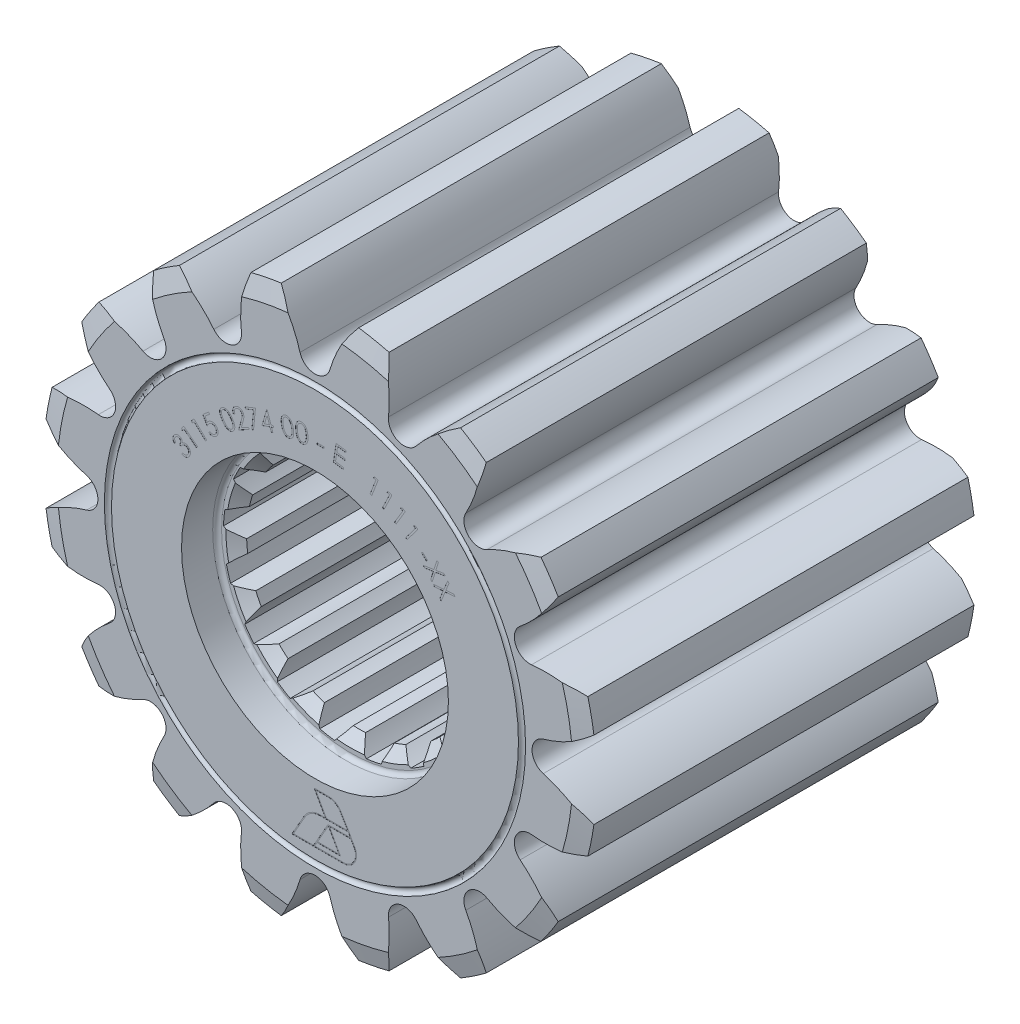
from build123d import *

# Parameters (mm, degrees)
CUT_EXTRUDE1_DEPTH = 63.106702537
CIRPATTERN1_COUNT  = 16
CUT_EXTRUDE2_DEPTH = 62.801274429
CIRPATTERN2_COUNT  = 17
PARTNO_DEPTH       = 0.01


with BuildPart() as part:
    # Sketch2 → Revolve1 (revolve)
    with BuildSketch(Plane(origin=(0, 0, 0), x_dir=(0, 0, -1), z_dir=(1, 0, 0))):
        with BuildLine():
            Line((0, 15), (0, 22.875))
            ThreePointArc((0, 22.875), (-0.4, 23.275), (0, 23.675))
            Line((0, 23.675), (0, 29))
            Line((0, 29), (-0.562693304, 31.1))
            Line((-0.562693304, 31.1), (-43.287306696, 31.1))
            Line((-43.287306696, 31.1), (-43.85, 29))
            Line((-43.85, 29), (-43.85, 23.675))
            ThreePointArc((-43.85, 23.675), (-43.45, 23.275), (-43.85, 22.875))
            Line((-43.85, 22.875), (-43.85, 15))
            Line((-43.85, 15), (-40.35, 15))
            ThreePointArc((-40.35, 15), (-39.996446609, 14.853553391), (-39.85, 14.5))
            Line((-39.85, 14.5), (-39.85, 14))
            Line((-39.85, 14), (-38.85, 12.69))
            Line((-38.85, 12.69), (-5, 12.69))
            Line((-5, 12.69), (-4, 14))
            Line((-4, 14), (-4, 14.5))
            ThreePointArc((-4, 14.5), (-3.853553391, 14.853553391), (-3.5, 15))
            Line((-3.5, 15), (0, 15))
        make_face()
    revolve(axis=Axis((0, 0, 0), (0, 0, 1)))

    # Sketch3 → Cut-Extrude1 (cut, through all)
    with BuildSketch(Plane.XY):
        with BuildLine():
            ThreePointArc((4.35, 30.794277066), (0, 31.1), (-4.35, 30.794277066))
            ThreePointArc((-4.35, 30.794277066), (-2.764629435, 28.35739577), (-1.679111514, 25.660463972))
            ThreePointArc((-1.679111514, 25.660463972), (0, 24.4035), (1.679111514, 25.660463972))
            ThreePointArc((1.679111514, 25.660463972), (2.764629435, 28.35739577), (4.35, 30.794277066))
        make_face()
    cut_extrude1 = extrude(amount=CUT_EXTRUDE1_DEPTH, mode=Mode.SUBTRACT)

    # CirPattern1: Cut-Extrude1 ×16 about axis
    cirpattern1_axis = Axis((0, 0, 5), (0, 0, 1))
    for i in range(1, CIRPATTERN1_COUNT):
        add(cut_extrude1.rotate(cirpattern1_axis, i * 360 / CIRPATTERN1_COUNT), mode=Mode.SUBTRACT)

    # Sketch4 → Cut-Extrude2 (cut, through all)
    with BuildSketch(Plane.XY):
        with BuildLine():
            ThreePointArc((0.85, 14.264697683), (0, 14.29), (-0.85, 14.264697683))
            ThreePointArc((-0.85, 14.264697683), (-1.276543067, 13.436106806), (-1.65, 12.582273245))
            ThreePointArc((-1.65, 12.582273245), (0, 12.69), (1.65, 12.582273245))
            ThreePointArc((1.65, 12.582273245), (1.276543067, 13.436106806), (0.85, 14.264697683))
        make_face()
    cut_extrude2 = extrude(amount=CUT_EXTRUDE2_DEPTH, mode=Mode.SUBTRACT)

    # CirPattern2: Cut-Extrude2 ×17 about axis
    cirpattern2_axis = Axis((0, 0, 5), (0, 0, 1))
    for i in range(1, CIRPATTERN2_COUNT):
        add(cut_extrude2.rotate(cirpattern2_axis, i * 360 / CIRPATTERN2_COUNT), mode=Mode.SUBTRACT)

    # Sketch5 → PARTNO (cut)
    # profile 1 of 20: a face of its own
    with BuildSketch(Plane.XY.offset(43.85)):
        with BuildLine():
            Line((-15.658012961, 9.888042357), (-15.772195653, 9.718971844))
            add(Edge.make_bspline(
                [(-15.772195653, 9.718971844), (-15.78603067, 9.734282455), (-15.813212263, 9.76436314), (-15.849555861, 9.811681363), (-15.881533398, 9.859466346), (-15.908380508, 9.908018341), (-15.930702895, 9.957121523), (-15.947902224, 10.007073924), (-15.96084882, 10.057556524), (-15.968939443, 10.108536251), (-15.971869176, 10.159362897), (-15.971410312, 10.209644733), (-15.965660473, 10.25899995), (-15.955525406, 10.30751364), (-15.941163164, 10.355155751), (-15.922077875, 10.402064167), (-15.898558566, 10.448025044), (-15.879809697, 10.477394814), (-15.870352704, 10.492209023)],
                knots=[0, 0, 0, 0, 1.167337146, 2.293461821, 3.372899211, 4.418145347, 5.429484345, 6.421322249, 7.403758633, 8.375351629, 9.337018697, 10.281789974, 11.217327747, 12.143663286, 13.083221491, 14.02908024, 15.005861512, 16, 16, 16, 16], degree=3))
            add(Edge.make_bspline(
                [(-15.870352704, 10.492209023), (-15.855426036, 10.513110766), (-15.825876427, 10.55448894), (-15.771947061, 10.607932078), (-15.713628984, 10.655684772), (-15.649302403, 10.694901857), (-15.581798296, 10.72598863), (-15.512576022, 10.748190148), (-15.442393007, 10.759956828), (-15.372186732, 10.761204484), (-15.303552586, 10.754405706), (-15.238317398, 10.738072312), (-15.17670949, 10.714336666), (-15.139677276, 10.691521615), (-15.121153987, 10.680109664)],
                knots=[0, 0, 0, 0, 1.077593829, 2.133260695, 3.178944316, 4.239701202, 5.289443528, 6.295878546, 7.285905084, 8.268330171, 9.238933244, 10.175446198, 11.087369189, 12, 12, 12, 12], degree=3))
            add(Edge.make_bspline(
                [(-15.121153987, 10.680109664), (-15.104048962, 10.667779614), (-15.07052077, 10.643611025), (-15.027817793, 10.599367332), (-14.991597877, 10.551170603), (-14.963403591, 10.497522355), (-14.94256879, 10.439378851), (-14.928850016, 10.376521279), (-14.923039757, 10.308946391), (-14.92449253, 10.26251142), (-14.925240525, 10.238603254)],
                knots=[0, 0, 0, 0, 0.995000218, 1.950336737, 2.893518646, 3.836763937, 4.803298618, 5.805085003, 6.869895052, 8, 8, 8, 8], degree=3))
            add(Edge.make_bspline(
                [(-14.925240525, 10.238603254), (-14.903646826, 10.252124466), (-14.861248556, 10.278672767), (-14.793012518, 10.30834961), (-14.723051343, 10.329462909), (-14.675101803, 10.335669785), (-14.651202063, 10.338763511)],
                knots=[0, 0, 0, 0, 1.036066809, 2.034271235, 3.020211564, 4, 4, 4, 4], degree=3))
            add(Edge.make_bspline(
                [(-14.651202063, 10.338763511), (-14.634383712, 10.339987219), (-14.601167849, 10.342404016), (-14.551716718, 10.34097381), (-14.503520305, 10.336081991), (-14.456749487, 10.325997972), (-14.410945833, 10.31320078), (-14.366924877, 10.29517883), (-14.323800578, 10.274025545), (-14.296743881, 10.25664062), (-14.283012961, 10.247817998)],
                knots=[0, 0, 0, 0, 1.044903547, 2.063660846, 3.063088482, 4.043924196, 5.026610512, 6.007586015, 6.988875973, 8, 8, 8, 8], degree=3))
            add(Edge.make_bspline(
                [(-14.283012961, 10.247817998), (-14.26033606, 10.231197929), (-14.215004844, 10.197974346), (-14.156006737, 10.137072555), (-14.105192038, 10.068165283), (-14.062610412, 9.992615653), (-14.029758389, 9.91204727), (-14.008109802, 9.828378177), (-13.999024483, 9.742566557), (-14.001434302, 9.655653685), (-14.015650138, 9.568806839), (-14.0409896, 9.483376473), (-14.078127339, 9.40008706), (-14.110630024, 9.34802106), (-14.127163602, 9.321535946)],
                knots=[0, 0, 0, 0, 0.966170603, 1.931378862, 2.9038575, 3.905996855, 4.907914887, 5.889924786, 6.86994318, 7.867604432, 8.873236304, 9.889647813, 10.926498726, 12, 12, 12, 12], degree=3))
            add(Edge.make_bspline(
                [(-14.127163602, 9.321535946), (-14.139333892, 9.304388267), (-14.16329502, 9.270627548), (-14.202907908, 9.224054182), (-14.245353393, 9.182777964), (-14.289308034, 9.145335953), (-14.336653744, 9.113829279), (-14.385780946, 9.086326154), (-14.437716665, 9.064239032), (-14.491558153, 9.046639635), (-14.547448343, 9.033926387), (-14.605100465, 9.02783744), (-14.664092891, 9.026509123), (-14.724579923, 9.031047253), (-14.786412986, 9.041338914), (-14.849990543, 9.056498495), (-14.914846551, 9.077872069), (-14.957802035, 9.095692904), (-14.979727704, 9.104789152)],
                knots=[0, 0, 0, 0, 1.043382585, 2.05423396, 3.029176167, 3.979702728, 4.915461935, 5.847056597, 6.770503734, 7.711670308, 8.655656949, 9.609436654, 10.584018272, 11.580952161, 12.615092949, 13.692247982, 14.82205938, 16, 16, 16, 16], degree=3))
            Line((-14.979727704, 9.104789152), (-14.870352704, 9.267048767))
            add(Edge.make_bspline(
                [(-14.870352704, 9.267048767), (-14.854903646, 9.26197229), (-14.824865207, 9.252101822), (-14.780389824, 9.239952888), (-14.737811157, 9.231186158), (-14.697315164, 9.224967595), (-14.658725357, 9.222034498), (-14.622165875, 9.222558897), (-14.587479555, 9.225342268), (-14.565425945, 9.230213095), (-14.554647576, 9.232593639)],
                knots=[0, 0, 0, 0, 1.212571523, 2.357668232, 3.435804907, 4.45268296, 5.411272589, 6.317584373, 7.177744739, 8, 8, 8, 8], degree=3))
            add(Edge.make_bspline(
                [(-14.554647576, 9.232593639), (-14.541475283, 9.236343763), (-14.515223191, 9.243817678), (-14.477316071, 9.259627156), (-14.441206888, 9.279430402), (-14.406616327, 9.302625803), (-14.374031743, 9.329902741), (-14.342741241, 9.360239925), (-14.313215249, 9.394560394), (-14.295621464, 9.419666649), (-14.28661873, 9.432513511)],
                knots=[0, 0, 0, 0, 0.960147248, 1.913552354, 2.873562481, 3.845339491, 4.830124943, 5.850366078, 6.900033086, 8, 8, 8, 8], degree=3))
            add(Edge.make_bspline(
                [(-14.28661873, 9.432513511), (-14.276987762, 9.447439666), (-14.258251452, 9.476477358), (-14.235399188, 9.521966459), (-14.216658839, 9.567088691), (-14.20343103, 9.612669853), (-14.194937836, 9.658155191), (-14.191114239, 9.703826726), (-14.193013037, 9.749467758), (-14.198835008, 9.794719862), (-14.209445906, 9.838447849), (-14.222913913, 9.88038558), (-14.240146889, 9.919763103), (-14.26105043, 9.956463394), (-14.28563971, 9.990205955), (-14.313559612, 10.021338157), (-14.344859196, 10.049920731), (-14.367914231, 10.066673827), (-14.379567448, 10.075141716)],
                knots=[0, 0, 0, 0, 1.175396333, 2.286643493, 3.365472874, 4.40641989, 5.422738212, 6.425112482, 7.43378543, 8.441760468, 9.441244357, 10.408768253, 11.355088161, 12.281871839, 13.199839301, 14.114093995, 15.046764744, 16, 16, 16, 16], degree=3))
            add(Edge.make_bspline(
                [(-14.379567448, 10.075141716), (-14.395983002, 10.085287024), (-14.428543266, 10.105410252), (-14.482370854, 10.126239723), (-14.539072139, 10.139063938), (-14.5979616, 10.144127213), (-14.657338468, 10.141616049), (-14.715411647, 10.130029565), (-14.771548332, 10.110876033), (-14.816249612, 10.087315493), (-14.851847972, 10.064186177), (-14.879378842, 10.042213583), (-14.908219878, 10.016914772), (-14.938500293, 9.98796165), (-14.969449118, 9.954632715), (-15.001879546, 9.91773512), (-15.035695083, 9.877339744), (-15.05770117, 9.848470515), (-15.069070653, 9.833555177)],
                knots=[0, 0, 0, 0, 1.128220603, 2.237826442, 3.361020691, 4.523001895, 5.689632671, 6.82928951, 7.979418312, 9.151280642, 9.778190339, 10.463464239, 11.211720144, 12.024852382, 12.915669657, 13.874354059, 14.901781287, 16, 16, 16, 16], degree=3))
            Line((-15.069070653, 9.833555177), (-15.220913602, 9.935718639))
            add(Edge.make_bspline(
                [(-15.220913602, 9.935718639), (-15.208730746, 9.954568824), (-15.184865336, 9.991495094), (-15.156902614, 10.050314155), (-15.135040061, 10.109538653), (-15.120298011, 10.168963806), (-15.112330712, 10.226310383), (-15.110466339, 10.280193186), (-15.116918082, 10.329666781), (-15.130191276, 10.37465202), (-15.149565423, 10.414928837), (-15.174029709, 10.4508141), (-15.203338062, 10.482551582), (-15.226489909, 10.499636575), (-15.238141166, 10.508234664)],
                knots=[0, 0, 0, 0, 1.266641371, 2.481266901, 3.669725102, 4.827869775, 5.932058831, 6.935622934, 7.863832331, 8.737401729, 9.574171888, 10.377635351, 11.183538646, 12, 12, 12, 12], degree=3))
            add(Edge.make_bspline(
                [(-15.238141166, 10.508234664), (-15.247276223, 10.51383784), (-15.265268427, 10.524873729), (-15.29349859, 10.539122218), (-15.323289999, 10.548142815), (-15.353594266, 10.555522063), (-15.384839921, 10.558230051), (-15.417059066, 10.559108187), (-15.450012007, 10.554995441), (-15.483680506, 10.548755245), (-15.516944482, 10.539412014), (-15.549014684, 10.526200866), (-15.579838201, 10.510484445), (-15.608737616, 10.490775673), (-15.636640215, 10.46899976), (-15.662261436, 10.443116231), (-15.687238182, 10.41509921), (-15.701882706, 10.394208906), (-15.709295012, 10.383635305)],
                knots=[0, 0, 0, 0, 0.948442214, 1.868030538, 2.787315117, 3.69605832, 4.622605299, 5.556208641, 6.542753651, 7.553212442, 8.58554517, 9.592751217, 10.618094201, 11.640641564, 12.683337582, 13.744550923, 14.858407392, 16, 16, 16, 16], degree=3))
            add(Edge.make_bspline(
                [(-15.709295012, 10.383635305), (-15.720367711, 10.365809656), (-15.741921839, 10.331110225), (-15.762748875, 10.274187427), (-15.774292555, 10.216338277), (-15.775406546, 10.166994673), (-15.770614549, 10.126970912), (-15.763626717, 10.095798758), (-15.753962577, 10.06349191), (-15.741093538, 10.030279945), (-15.724872928, 9.996094207), (-15.705548998, 9.960821257), (-15.68317431, 9.924476325), (-15.666538707, 9.900387751), (-15.658012961, 9.888042357)],
                knots=[0, 0, 0, 0, 1.40594964, 2.736823161, 4.04354908, 5.353102882, 6.030502128, 6.746399528, 7.495399949, 8.29311798, 9.135552555, 10.034467578, 10.992664621, 12, 12, 12, 12], degree=3))
        make_face()
    # profile 2 of 20: a face of its own
    with BuildSketch(Plane.XY.offset(43.85)):
        Polygon((-14.99389279, 11.628714865), (-14.754710097, 11.936006531), (-13.18940561, 10.717657172), (-13.309998559, 10.562609096), (-14.722258174, 11.66196807), (-14.913764585, 11.41597448), align=None)
    # profile 3 of 20: a face of its own
    with BuildSketch(Plane.XY.offset(43.85)):
        Polygon((-13.867040068, 12.941965881), (-13.599411863, 13.224017163), (-12.162713145, 11.860635753), (-12.298129811, 11.718007548), (-13.594203529, 12.947975497), (-13.808145837, 12.722414599), align=None)
    # profile 4 of 20: a face of its own
    with BuildSketch(Plane.XY.offset(43.85)):
        with BuildLine():
            Line((-11.963568043, 14.704354369), (-11.841773171, 14.560924882))
            Line((-11.841773171, 14.560924882), (-12.379433427, 14.104995395))
            Line((-12.379433427, 14.104995395), (-12.104994325, 13.629434498))
            add(Edge.make_bspline(
                [(-12.104994325, 13.629434498), (-12.092787255, 13.647349966), (-12.069067944, 13.682161149), (-12.031210576, 13.730074027), (-11.992582336, 13.772378648), (-11.96523546, 13.796972957), (-11.951949453, 13.808921677)],
                knots=[0, 0, 0, 0, 1.099131261, 2.135699657, 3.094261902, 4, 4, 4, 4], degree=3))
            add(Edge.make_bspline(
                [(-11.951949453, 13.808921677), (-11.934837089, 13.82274721), (-11.901173753, 13.849944711), (-11.847106583, 13.88438354), (-11.791814018, 13.913063707), (-11.735011793, 13.935247493), (-11.676868499, 13.951080361), (-11.617319001, 13.960182192), (-11.556400409, 13.963338919), (-11.494627577, 13.960689402), (-11.43324665, 13.951251279), (-11.373165565, 13.93680844), (-11.315603479, 13.914924484), (-11.259594982, 13.888532871), (-11.206605219, 13.854452669), (-11.154950287, 13.815752214), (-11.106044922, 13.77016034), (-11.075886506, 13.736384311), (-11.060523171, 13.719178087)],
                knots=[0, 0, 0, 0, 1.050539669, 2.066615009, 3.056975083, 4.02279115, 4.974826581, 5.930618768, 6.89557008, 7.885703971, 8.87934815, 9.859062771, 10.832271467, 11.816961396, 12.811998036, 13.83687263, 14.898057196, 16, 16, 16, 16], degree=3))
            add(Edge.make_bspline(
                [(-11.060523171, 13.719178087), (-11.050367521, 13.706733613), (-11.03015892, 13.68197051), (-11.002594518, 13.643250711), (-10.978025438, 13.603338669), (-10.956275722, 13.56241258), (-10.937646131, 13.520243898), (-10.920872256, 13.477373436), (-10.907771262, 13.433094566), (-10.897488199, 13.388112346), (-10.889717396, 13.342921804), (-10.88546118, 13.29805894), (-10.883680677, 13.253638134), (-10.885269225, 13.209705245), (-10.890191553, 13.166359491), (-10.897760139, 13.123483999), (-10.908663448, 13.081232994), (-10.922172817, 13.03936788), (-10.939205335, 12.99852488), (-10.958620199, 12.958505943), (-10.98138085, 12.919842309), (-11.006653081, 12.882010725), (-11.034956716, 12.845263508), (-11.066587719, 12.809971887), (-11.100484399, 12.775228376), (-11.125267108, 12.753729039), (-11.137846889, 12.742815908)],
                knots=[0, 0, 0, 0, 1.05363616, 2.096617237, 3.115471272, 4.126686536, 5.13463208, 6.138609318, 7.144839728, 8.160788728, 9.164765966, 10.150804986, 11.115235929, 12.079666873, 13.03176054, 13.975309265, 14.933711583, 15.892394212, 16.858892534, 17.834600516, 18.808378935, 19.799852856, 20.818066232, 21.848384, 22.907832969, 24, 24, 24, 24], degree=3))
            add(Edge.make_bspline(
                [(-11.137846889, 12.742815908), (-11.15312175, 12.730371194), (-11.183137929, 12.705916453), (-11.231235276, 12.674754671), (-11.280109946, 12.647987393), (-11.330518927, 12.626780463), (-11.381933128, 12.610094452), (-11.434728294, 12.599008511), (-11.48861899, 12.592420413), (-11.543216821, 12.591419977), (-11.597657866, 12.594913977), (-11.651148028, 12.603419819), (-11.703461009, 12.616439237), (-11.75387113, 12.635305871), (-11.803343442, 12.657625998), (-11.850944832, 12.685512981), (-11.897363611, 12.718041698), (-11.92637656, 12.742962198), (-11.941132145, 12.755636421)],
                knots=[0, 0, 0, 0, 1.071381455, 2.105340204, 3.113308462, 4.099938, 5.076642761, 6.050098149, 7.03076872, 8.026561537, 9.017010525, 9.995470858, 10.970118941, 11.944848291, 12.920335805, 13.919939473, 14.942109929, 16, 16, 16, 16], degree=3))
            Line((-11.941132145, 12.755636421), (-11.786084069, 12.887046677))
            add(Edge.make_bspline(
                [(-11.786084069, 12.887046677), (-11.771255793, 12.875574601), (-11.742640548, 12.853436069), (-11.696944609, 12.827643075), (-11.652324871, 12.80735055), (-11.60749851, 12.794448075), (-11.562381004, 12.787330388), (-11.516240413, 12.787077599), (-11.468871174, 12.790669531), (-11.421004855, 12.801078852), (-11.373855966, 12.815827656), (-11.328969621, 12.836260064), (-11.286508677, 12.860897714), (-11.260881765, 12.881244498), (-11.248023171, 12.891453728)],
                knots=[0, 0, 0, 0, 1.14831658, 2.21599331, 3.209739271, 4.148003331, 5.067710377, 6.001531398, 6.971433548, 7.975353789, 8.998467386, 9.995549036, 10.99424398, 12, 12, 12, 12], degree=3))
            add(Edge.make_bspline(
                [(-11.248023171, 12.891453728), (-11.235997202, 12.902131147), (-11.212345932, 12.923130246), (-11.182002112, 12.958954894), (-11.155142604, 12.996428973), (-11.132557637, 13.036490251), (-11.115049193, 13.079409694), (-11.101267861, 13.12442946), (-11.092101721, 13.171973153), (-11.087500503, 13.221330216), (-11.086779645, 13.271380922), (-11.091859646, 13.320862456), (-11.101028864, 13.369314903), (-11.114979535, 13.416813636), (-11.134542787, 13.462900456), (-11.158276072, 13.508223948), (-11.187157392, 13.552247153), (-11.209462167, 13.580063903), (-11.220779581, 13.594178087)],
                knots=[0, 0, 0, 0, 0.98452814, 1.936254788, 2.869679, 3.807792646, 4.747190891, 5.70523205, 6.689249692, 7.708943406, 8.740298234, 9.751845218, 10.751935582, 11.759367871, 12.779357201, 13.815507849, 14.891591448, 16, 16, 16, 16], degree=3))
            add(Edge.make_bspline(
                [(-11.220779581, 13.594178087), (-11.231667892, 13.606382498), (-11.25294185, 13.630227898), (-11.287631088, 13.662269643), (-11.324277474, 13.689355661), (-11.361812069, 13.712955673), (-11.401311951, 13.731459643), (-11.442021226, 13.746079073), (-11.484583746, 13.755523625), (-11.528026788, 13.761181021), (-11.572072651, 13.762462907), (-11.615882259, 13.758864355), (-11.659258309, 13.750295147), (-11.702019649, 13.736976434), (-11.744396624, 13.719344593), (-11.785903461, 13.696437481), (-11.827173123, 13.669401111), (-11.853300051, 13.64823329), (-11.866612915, 13.637447318)],
                knots=[0, 0, 0, 0, 1.076572751, 2.103445133, 3.102377437, 4.073640714, 5.017652726, 5.968804855, 6.91592433, 7.882279082, 8.849913245, 9.811656064, 10.770500121, 11.755125864, 12.756223206, 13.787153794, 14.872453723, 16, 16, 16, 16], degree=3))
            add(Edge.make_bspline(
                [(-11.866612915, 13.637447318), (-11.877826653, 13.627434554), (-11.900808844, 13.606913721), (-11.933789559, 13.572554729), (-11.966048959, 13.534187511), (-11.997805746, 13.491559171), (-12.029869703, 13.44543178), (-12.06096342, 13.394699125), (-12.091917691, 13.340220354), (-12.111417936, 13.302055877), (-12.121420607, 13.282479369)],
                knots=[0, 0, 0, 0, 0.820229352, 1.681033294, 2.596504991, 3.554202986, 4.581222254, 5.661284729, 6.800353633, 8, 8, 8, 8], degree=3))
            Line((-12.121420607, 13.282479369), (-12.617414197, 14.14986719))
            Line((-12.617414197, 14.14986719), (-11.963568043, 14.704354369))
        make_face()
    # profile 5 of 20: a face of its own
    with BuildSketch(Plane.XY.offset(43.85)):
        with BuildLine():
            add(Edge.make_bspline(
                [(-10.423501321, 14.666894241), (-10.441033057, 14.693628941), (-10.475094486, 14.745570293), (-10.521825343, 14.822899957), (-10.563824645, 14.89675066), (-10.600376112, 14.96750362), (-10.631298772, 15.035333013), (-10.65712283, 15.099867061), (-10.677700983, 15.161236876), (-10.693262731, 15.219706045), (-10.703427314, 15.27605434), (-10.711005078, 15.330424299), (-10.714148141, 15.383466682), (-10.713662798, 15.434846213), (-10.710341946, 15.484841993), (-10.702595627, 15.533314257), (-10.691435175, 15.580361254), (-10.676540149, 15.625590392), (-10.658572319, 15.669055849), (-10.637075666, 15.710178583), (-10.613801855, 15.749730304), (-10.586523046, 15.786261318), (-10.556827376, 15.82082358), (-10.524343809, 15.853455117), (-10.48869878, 15.883460884), (-10.463166473, 15.901449957), (-10.45034427, 15.910483985)],
                knots=[0, 0, 0, 0, 1.644967455, 3.195915158, 4.648340801, 6.016002329, 7.292214278, 8.482797758, 9.59106982, 10.621143005, 11.592902142, 12.535629301, 13.444383189, 14.324011973, 15.178367853, 16.020055184, 16.846769561, 17.663860131, 18.46787128, 19.263884175, 20.049957525, 20.82651152, 21.606160697, 22.393344639, 23.193145275, 24, 24, 24, 24], degree=3))
            add(Edge.make_bspline(
                [(-10.45034427, 15.910483985), (-10.436848927, 15.91911148), (-10.410162602, 15.936171895), (-10.368200095, 15.957845452), (-10.325326955, 15.975928787), (-10.28133343, 15.990315298), (-10.236560854, 16.001792474), (-10.190515421, 16.008743474), (-10.143674753, 16.0129186), (-10.095865536, 16.013157763), (-10.047442076, 16.010268951), (-9.998778122, 16.00221673), (-9.949646417, 15.99122591), (-9.900437952, 15.975389117), (-9.851041368, 15.955719395), (-9.801598787, 15.931872169), (-9.751877764, 15.904113331), (-9.70156915, 15.872373114), (-9.65087118, 15.83588976), (-9.600363689, 15.79347656), (-9.549477706, 15.74566217), (-9.498207351, 15.69235947), (-9.446943796, 15.633221221), (-9.395443684, 15.568641249), (-9.343024173, 15.498838193), (-9.309388716, 15.449486033), (-9.292091065, 15.42410578)],
                knots=[0, 0, 0, 0, 0.81782486, 1.617205255, 2.409040569, 3.192100259, 3.979633851, 4.766931052, 5.567968798, 6.379768505, 7.206984855, 8.042513177, 8.896386365, 9.776611395, 10.679798136, 11.610391136, 12.578410356, 13.587131832, 14.647381377, 15.76622865, 16.953462394, 18.212653889, 19.542307108, 20.949642497, 22.431297708, 24, 24, 24, 24], degree=3))
            add(Edge.make_bspline(
                [(-9.292091065, 15.42410578), (-9.275390598, 15.398555207), (-9.242888348, 15.348828989), (-9.197711915, 15.274635605), (-9.158124409, 15.202460125), (-9.123188955, 15.132917997), (-9.093174221, 15.065790688), (-9.068883713, 15.000934849), (-9.048902225, 14.938563637), (-9.034066019, 14.8784293), (-9.023651235, 14.820186859), (-9.016595928, 14.763885077), (-9.014036053, 14.709130369), (-9.014066595, 14.655982181), (-9.018630754, 14.604439477), (-9.026429456, 14.554400326), (-9.038762052, 14.506313509), (-9.053694686, 14.459673166), (-9.072802529, 14.415471245), (-9.093831787, 14.373018854), (-9.118464741, 14.333361204), (-9.145822071, 14.295772494), (-9.176302892, 14.260723672), (-9.209273721, 14.227533206), (-9.245371433, 14.197007916), (-9.271376479, 14.178848291), (-9.284478885, 14.169698728)],
                knots=[0, 0, 0, 0, 1.560904059, 3.037812823, 4.440742805, 5.769295793, 7.0167373, 8.198912288, 9.309084471, 10.364179891, 11.363496816, 12.333398191, 13.263409103, 14.164899323, 15.049072923, 15.906847311, 16.751582024, 17.585201322, 18.408405248, 19.211651137, 20.005787516, 20.792578134, 21.586655782, 22.3786162, 23.183080491, 24, 24, 24, 24], degree=3))
            add(Edge.make_bspline(
                [(-9.284478885, 14.169698728), (-9.297693936, 14.161179134), (-9.323919126, 14.14427205), (-9.365431932, 14.123310431), (-9.40747026, 14.105053115), (-9.450500927, 14.090614737), (-9.494435302, 14.079703595), (-9.53933708, 14.072491596), (-9.585291863, 14.069044475), (-9.632029937, 14.068440756), (-9.679358311, 14.072066582), (-9.726829578, 14.079960338), (-9.774564203, 14.090804775), (-9.822094737, 14.107076178), (-9.870091428, 14.125924734), (-9.917993811, 14.149557954), (-9.966043022, 14.176797059), (-10.014569305, 14.208199068), (-10.063171023, 14.245017462), (-10.112736704, 14.287213765), (-10.162487136, 14.335917394), (-10.213643359, 14.39011839), (-10.265140132, 14.450750024), (-10.31744566, 14.517319168), (-10.371050777, 14.589533933), (-10.405663336, 14.640584657), (-10.423501321, 14.666894241)],
                knots=[0, 0, 0, 0, 0.809338187, 1.606126822, 2.391913194, 3.168462716, 3.940888532, 4.721176236, 5.507775071, 6.312599149, 7.126629867, 7.948757715, 8.789663222, 9.644519673, 10.533535469, 11.444136736, 12.392883168, 13.377362539, 14.418781525, 15.531200266, 16.727876733, 18.00281129, 19.368899368, 20.823472518, 22.362939638, 24, 24, 24, 24], degree=3))
        make_face()
        with BuildLine():
            add(Edge.make_bspline(
                [(-10.264847475, 14.768256421), (-10.249462701, 14.745613091), (-10.219725176, 14.701845366), (-10.174768379, 14.639439152), (-10.13087507, 14.582694251), (-10.088127527, 14.531348073), (-10.047646994, 14.484481939), (-10.00739712, 14.443823245), (-9.969159628, 14.407783854), (-9.920212704, 14.368456072), (-9.859653778, 14.328302458), (-9.785946792, 14.291410975), (-9.711610946, 14.267611202), (-9.63769441, 14.256783201), (-9.566212388, 14.257632204), (-9.498626888, 14.268372111), (-9.435386849, 14.289186924), (-9.398032654, 14.31185558), (-9.379430808, 14.323144241)],
                knots=[0, 0, 0, 0, 1.186368033, 2.293153526, 3.332752926, 4.294628182, 5.188637686, 6.015369353, 6.773029273, 7.464509494, 8.734249627, 9.914559812, 11.025634719, 12.101978004, 13.138043125, 14.111428927, 15.059519053, 16, 16, 16, 16], degree=3))
            add(Edge.make_bspline(
                [(-9.379430808, 14.323144241), (-9.361789892, 14.336153364), (-9.326587262, 14.362113202), (-9.283281712, 14.412381743), (-9.246919263, 14.469379522), (-9.224912847, 14.523039307), (-9.210848218, 14.568824325), (-9.203899261, 14.605252918), (-9.199428939, 14.642868682), (-9.197755947, 14.681721697), (-9.199604583, 14.722010601), (-9.203858068, 14.763535017), (-9.211665371, 14.806316623), (-9.218750982, 14.834932399), (-9.222379526, 14.849586549)],
                knots=[0, 0, 0, 0, 1.338094024, 2.670180411, 4.033364491, 5.462214199, 6.204569503, 6.962958325, 7.728583636, 8.522285071, 9.340492924, 10.195491895, 11.075910709, 12, 12, 12, 12], degree=3))
            add(Edge.make_bspline(
                [(-9.222379526, 14.849586549), (-9.22755477, 14.867932735), (-9.238096719, 14.905303834), (-9.257353206, 14.96138959), (-9.280473896, 15.018308185), (-9.306249897, 15.07638083), (-9.336326998, 15.135130573), (-9.369478781, 15.194979363), (-9.40585594, 15.256067935), (-9.432418227, 15.296271968), (-9.445937218, 15.316733985)],
                knots=[0, 0, 0, 0, 0.879272783, 1.79107468, 2.733761226, 3.712731416, 4.721151167, 5.777314731, 6.868754672, 8, 8, 8, 8], degree=3))
            add(Edge.make_bspline(
                [(-9.445937218, 15.316733985), (-9.459684023, 15.336999573), (-9.486567044, 15.376630617), (-9.528332053, 15.433000382), (-9.56965238, 15.485721125), (-9.610691263, 15.53447199), (-9.651645883, 15.57920465), (-9.692668907, 15.619727047), (-9.733218102, 15.656638809), (-9.773970062, 15.689127358), (-9.81406659, 15.718244733), (-9.854043179, 15.743378328), (-9.893535557, 15.765106184), (-9.932253256, 15.783869591), (-9.971014899, 15.798112813), (-10.008906356, 15.809673008), (-10.046675294, 15.816798752), (-10.095208164, 15.822065402), (-10.154061623, 15.821308277), (-10.221071888, 15.81063754), (-10.283896764, 15.790126244), (-10.320894249, 15.767790056), (-10.339366706, 15.756637831)],
                knots=[0, 0, 0, 0, 1.32650343, 2.594087775, 3.799725531, 4.954878166, 6.045516721, 7.084037545, 8.077821164, 9.014502396, 9.90600373, 10.761093201, 11.570619691, 12.347312648, 13.089086596, 13.805627962, 14.490954791, 15.167673383, 16.448321719, 17.665087511, 18.834202651, 20, 20, 20, 20], degree=3))
            add(Edge.make_bspline(
                [(-10.339366706, 15.756637831), (-10.357008527, 15.74363499), (-10.392293817, 15.717628096), (-10.435731318, 15.667043532), (-10.471255055, 15.608921401), (-10.49403349, 15.554964901), (-10.507747003, 15.508609866), (-10.515481143, 15.472056545), (-10.51973378, 15.434228801), (-10.521332323, 15.39513472), (-10.520103193, 15.354837494), (-10.515957866, 15.313236859), (-10.509278678, 15.270501287), (-10.498989022, 15.226227251), (-10.48524549, 15.179750029), (-10.467137069, 15.130334343), (-10.443943288, 15.078051953), (-10.417260645, 15.022096518), (-10.385140621, 14.963414734), (-10.349846207, 14.900786707), (-10.308988336, 14.835489306), (-10.279890814, 14.791169591), (-10.264847475, 14.768256421)],
                knots=[0, 0, 0, 0, 1.183886092, 2.367882665, 3.58241874, 4.862742988, 5.526479669, 6.198909395, 6.883484435, 7.585716171, 8.316607222, 9.065145878, 9.848822381, 10.657730111, 11.525159868, 12.472536081, 13.505918993, 14.622061045, 15.829186403, 17.128313856, 18.5153462, 20, 20, 20, 20], degree=3))
        make_face(mode=Mode.SUBTRACT)
    # profile 6 of 20: a face of its own
    with BuildSketch(Plane.XY.offset(43.85)):
        with BuildLine():
            Line((-8.99711459, 15.99260797), (-9.166585744, 15.905268226))
            add(Edge.make_bspline(
                [(-9.166585744, 15.905268226), (-9.176647299, 15.927125007), (-9.196429497, 15.970098002), (-9.217964356, 16.036499141), (-9.234581018, 16.102116293), (-9.243841192, 16.167664708), (-9.246032257, 16.232882873), (-9.242681466, 16.297865652), (-9.232068385, 16.362400488), (-9.215279891, 16.42598821), (-9.19259631, 16.487298019), (-9.164545277, 16.545360566), (-9.130913467, 16.599209551), (-9.093011561, 16.649784819), (-9.04888159, 16.695421757), (-8.999970779, 16.737438077), (-8.946032161, 16.775681083), (-8.906801748, 16.797078404), (-8.886938308, 16.807912457)],
                knots=[0, 0, 0, 0, 1.096079278, 2.155020467, 3.176888625, 4.179142562, 5.166153197, 6.147929463, 7.140875114, 8.142148436, 9.14193976, 10.116781875, 11.076466755, 12.032378095, 12.992680805, 13.964113605, 14.969174568, 16, 16, 16, 16], degree=3))
            add(Edge.make_bspline(
                [(-8.886938308, 16.807912457), (-8.866787995, 16.817595466), (-8.82728682, 16.836577318), (-8.766628004, 16.85883375), (-8.70614855, 16.873969822), (-8.646229992, 16.883593127), (-8.586535012, 16.885915586), (-8.527355167, 16.881748111), (-8.468424767, 16.871925425), (-8.410746782, 16.85483723), (-8.355085483, 16.832905299), (-8.302277388, 16.807047956), (-8.253649169, 16.776254401), (-8.208395442, 16.741870158), (-8.167492755, 16.702613473), (-8.129935342, 16.659642834), (-8.096529447, 16.612130337), (-8.077605911, 16.577994353), (-8.068028051, 16.560716944)],
                knots=[0, 0, 0, 0, 1.123351482, 2.202134749, 3.240867871, 4.25292574, 5.247240623, 6.236307225, 7.230644767, 8.244015279, 9.253732869, 10.235413923, 11.194597187, 12.142509588, 13.08739849, 14.039059002, 15.007499562, 16, 16, 16, 16], degree=3))
            add(Edge.make_bspline(
                [(-8.068028051, 16.560716944), (-8.056090174, 16.535628235), (-8.032351163, 16.485738196), (-8.009622242, 16.406069268), (-7.996133781, 16.324469681), (-7.993506139, 16.254193809), (-7.996822313, 16.194830403), (-8.002341245, 16.145022781), (-8.009732879, 16.090026989), (-8.021012308, 16.030029254), (-8.033882238, 15.96471105), (-8.05077965, 15.894613591), (-8.069388885, 15.8191966), (-8.083537731, 15.767417913), (-8.09086459, 15.740604765)],
                knots=[0, 0, 0, 0, 1.186265919, 2.358943735, 3.527722176, 4.7163497, 5.35682411, 6.068786127, 6.858589431, 7.728904931, 8.678573026, 9.704940914, 10.811523368, 12, 12, 12, 12], degree=3))
            Line((-8.09086459, 15.740604765), (-8.285576128, 15.038681688))
            Line((-8.285576128, 15.038681688), (-7.469470359, 15.460156047))
            Line((-7.469470359, 15.460156047), (-7.381329333, 15.28948297))
            Line((-7.381329333, 15.28948297), (-8.582050487, 14.669290662))
            Line((-8.582050487, 14.669290662), (-8.283172282, 15.747816303))
            add(Edge.make_bspline(
                [(-8.283172282, 15.747816303), (-8.275858981, 15.773964194), (-8.261783907, 15.824288044), (-8.243150804, 15.89716558), (-8.226544697, 15.964002821), (-8.212833112, 16.024900584), (-8.202037068, 16.079967257), (-8.193390507, 16.129079553), (-8.187791355, 16.17253626), (-8.18320399, 16.222065365), (-8.184140049, 16.279357213), (-8.192569477, 16.345325339), (-8.210672815, 16.408732391), (-8.229088332, 16.448350402), (-8.238300487, 16.468168867)],
                knots=[0, 0, 0, 0, 1.320907501, 2.542199334, 3.659460898, 4.671447108, 5.578691368, 6.389416251, 7.09698972, 7.709938521, 8.808049694, 9.876703194, 10.93784462, 12, 12, 12, 12], degree=3))
            add(Edge.make_bspline(
                [(-8.238300487, 16.468168867), (-8.244853991, 16.48021309), (-8.257861524, 16.504118716), (-8.281616292, 16.536727946), (-8.307916721, 16.566548761), (-8.337362049, 16.592759154), (-8.36897958, 16.616933207), (-8.404209899, 16.63658843), (-8.441677169, 16.654208055), (-8.481770473, 16.667856656), (-8.523035865, 16.678266026), (-8.564610107, 16.684740022), (-8.605942559, 16.687283699), (-8.647310208, 16.685206219), (-8.688375492, 16.678785401), (-8.729221137, 16.668127192), (-8.770008659, 16.653848517), (-8.796245556, 16.640987987), (-8.80961459, 16.634434893)],
                knots=[0, 0, 0, 0, 0.993518432, 1.971956371, 2.918671676, 3.871855343, 4.826858018, 5.798754366, 6.791139075, 7.826457373, 8.86476152, 9.874343627, 10.873652199, 11.862770217, 12.872352325, 13.882491802, 14.921021799, 16, 16, 16, 16], degree=3))
            add(Edge.make_bspline(
                [(-8.80961459, 16.634434893), (-8.823250547, 16.626932694), (-8.850007614, 16.612211554), (-8.887114328, 16.586238955), (-8.920808418, 16.557971974), (-8.950757302, 16.526814443), (-8.977000231, 16.492993599), (-8.999315642, 16.456271689), (-9.018801614, 16.41743168), (-9.033907601, 16.375998782), (-9.045228895, 16.332690784), (-9.051936788, 16.287704037), (-9.054463815, 16.241405163), (-9.051820797, 16.193924823), (-9.044978728, 16.14527138), (-9.033492474, 16.095369359), (-9.018079226, 16.043938073), (-9.004216775, 16.009997058), (-8.99711459, 15.99260797)],
                knots=[0, 0, 0, 0, 1.002823315, 1.967783385, 2.914790766, 3.834312858, 4.748822572, 5.668828284, 6.600683831, 7.545967384, 8.506615451, 9.482006173, 10.473528871, 11.490848051, 12.542917543, 13.637466525, 14.789597058, 16, 16, 16, 16], degree=3))
        make_face()
    # profile 7 of 20: a face of its own
    with BuildSketch(Plane.XY.offset(43.85)):
        Polygon((-7.85713561, 17.270122618), (-6.688866379, 17.742077746), (-6.911222148, 15.456020054), (-7.094315097, 15.472446336), (-6.903609968, 17.453215567), (-7.786622789, 17.096244413), align=None)
    # profile 8 of 20: a face of its own
    with BuildSketch(Plane.XY.offset(43.85)):
        Polygon((-5.414723643, 18.2509582), (-5.376662746, 18.263778713), (-4.936358259, 16.954884482), (-4.708794156, 17.031807559), (-4.648297361, 16.851519098), (-4.875861464, 16.774596021), (-4.728826208, 16.337897303), (-4.916326208, 16.274996662), (-5.063361464, 16.71169538), (-5.961198002, 16.409612046), align=None)
        Polygon((-5.123858259, 16.891983841), (-5.387480054, 17.674836405), (-5.677143515, 16.705685764), align=None, mode=Mode.SUBTRACT)
    # profile 9 of 20: a face of its own
    with BuildSketch(Plane.XY.offset(43.85)):
        with BuildLine():
            add(Edge.make_bspline(
                [(-3.760466062, 17.591707204), (-3.766003684, 17.623058822), (-3.776748456, 17.683891063), (-3.789178204, 17.773018801), (-3.798075479, 17.857062179), (-3.803470251, 17.93618323), (-3.804982143, 18.010373147), (-3.803799718, 18.079669333), (-3.798198638, 18.143906768), (-3.788982816, 18.203460524), (-3.776230327, 18.258974771), (-3.761851298, 18.311654035), (-3.743387749, 18.361081858), (-3.723202295, 18.408102802), (-3.699890649, 18.452310409), (-3.67387334, 18.493539697), (-3.645214, 18.53212188), (-3.613515516, 18.567427864), (-3.580127726, 18.600506264), (-3.54408421, 18.629608665), (-3.507049069, 18.656345461), (-3.467773104, 18.679019534), (-3.427349752, 18.699494575), (-3.384599469, 18.7155119), (-3.340487284, 18.729690387), (-3.309954324, 18.735703139), (-3.294520549, 18.73874246)],
                knots=[0, 0, 0, 0, 1.645540889, 3.192879567, 4.65044638, 6.013298492, 7.29065515, 8.4851963, 9.593899089, 10.620988254, 11.597344332, 12.537017154, 13.441127958, 14.322175813, 15.18059591, 16.021348267, 16.840047272, 17.661535324, 18.471868398, 19.266465351, 20.053681753, 20.830324878, 21.608286036, 22.392834517, 23.187611358, 24, 24, 24, 24], degree=3))
            add(Edge.make_bspline(
                [(-3.294520549, 18.73874246), (-3.278789467, 18.741209717), (-3.247705962, 18.746084842), (-3.200968666, 18.749906816), (-3.154634857, 18.749169495), (-3.108761578, 18.74597138), (-3.063392985, 18.738014292), (-3.018513329, 18.726847164), (-2.974027646, 18.712011534), (-2.930241274, 18.693499265), (-2.887369795, 18.671437405), (-2.845527494, 18.64584627), (-2.805341937, 18.615899343), (-2.76651739, 18.582274783), (-2.729239622, 18.544737127), (-2.692981177, 18.503875685), (-2.658603715, 18.458695911), (-2.625201864, 18.409758581), (-2.593479232, 18.356313744), (-2.56370416, 18.297870181), (-2.536200389, 18.234108801), (-2.510745503, 18.164997582), (-2.486582119, 18.091055761), (-2.465199245, 18.011649924), (-2.444988192, 17.927266048), (-2.433716877, 17.86886565), (-2.427934011, 17.838902716)],
                knots=[0, 0, 0, 0, 0.817462823, 1.615248705, 2.403817145, 3.194766893, 3.973707127, 4.765310479, 5.567592125, 6.37881953, 7.203753934, 8.041077048, 8.894087776, 9.773932431, 10.675759109, 11.608493398, 12.576743852, 13.588519609, 14.649229165, 15.765465778, 16.953939418, 18.212317582, 19.545883848, 20.946513464, 22.433376836, 24, 24, 24, 24], degree=3))
            add(Edge.make_bspline(
                [(-2.427934011, 17.838902716), (-2.422649246, 17.809021997), (-2.412341264, 17.750739381), (-2.400770511, 17.664934268), (-2.39268158, 17.583421162), (-2.388120303, 17.506030373), (-2.387283993, 17.432899304), (-2.389802397, 17.363717093), (-2.39673893, 17.298861523), (-2.406636043, 17.237958538), (-2.420038355, 17.180756891), (-2.435966902, 17.126528107), (-2.454849551, 17.075336984), (-2.475948116, 17.026791699), (-2.500624102, 16.981629585), (-2.527278836, 16.938928376), (-2.557155753, 16.899480833), (-2.589555246, 16.863159063), (-2.62405071, 16.829736279), (-2.660541171, 16.799845889), (-2.698394304, 16.772689787), (-2.738086568, 16.748860037), (-2.779935026, 16.729181069), (-2.822923065, 16.711515121), (-2.867918107, 16.697950943), (-2.898767702, 16.69150811), (-2.914312216, 16.688261691)],
                knots=[0, 0, 0, 0, 1.55844597, 3.039763128, 4.445778609, 5.764932801, 7.020268198, 8.201052473, 9.318368243, 10.368229284, 11.36821287, 12.334017645, 13.269331752, 14.169161958, 15.049993946, 15.910151638, 16.752483873, 17.588142621, 18.407970859, 19.216850422, 20.008651993, 20.799174953, 21.590709079, 22.381708042, 23.184573982, 24, 24, 24, 24], degree=3))
            add(Edge.make_bspline(
                [(-2.914312216, 16.688261691), (-2.929772127, 16.685745337), (-2.960433339, 16.680754721), (-3.006549144, 16.677653221), (-3.05205901, 16.678181714), (-3.097140023, 16.681471263), (-3.141642798, 16.689484475), (-3.185888973, 16.699933872), (-3.229209138, 16.715210619), (-3.272089562, 16.73299295), (-3.313994118, 16.754703485), (-3.354240392, 16.780478062), (-3.393498333, 16.8093189), (-3.43067797, 16.842510689), (-3.466813532, 16.878917401), (-3.501404103, 16.919282916), (-3.534403431, 16.963289263), (-3.566624236, 17.010991854), (-3.596645685, 17.063795608), (-3.625027496, 17.122046102), (-3.65187409, 17.185989495), (-3.677031199, 17.255823917), (-3.70048461, 17.331536205), (-3.722640963, 17.412996742), (-3.742408407, 17.5003805), (-3.754334138, 17.56069496), (-3.760466062, 17.591707204)],
                knots=[0, 0, 0, 0, 0.809962268, 1.606375682, 2.387082306, 3.163343916, 3.941355906, 4.723863964, 5.512568998, 6.314506803, 7.124085949, 7.95015219, 8.784725914, 9.641313407, 10.525538063, 11.436745205, 12.388759485, 13.369810358, 14.412671444, 15.528068801, 16.720084109, 17.998555461, 19.366430825, 20.819447246, 22.364636301, 24, 24, 24, 24], degree=3))
        make_face()
        with BuildLine():
            add(Edge.make_bspline(
                [(-3.574969267, 17.621755281), (-3.569933057, 17.595010821), (-3.560184017, 17.543239184), (-3.543241105, 17.468737064), (-3.525623499, 17.399664343), (-3.507389869, 17.335817554), (-3.487708072, 17.277327158), (-3.467462352, 17.224039167), (-3.446327038, 17.176221599), (-3.424067845, 17.133547083), (-3.400515185, 17.095178501), (-3.376112666, 17.059706478), (-3.350189932, 17.027241472), (-3.322618827, 16.998052503), (-3.294794102, 16.970813291), (-3.26487452, 16.947116007), (-3.233676033, 16.926406104), (-3.191439967, 16.902493766), (-3.137142286, 16.88029702), (-3.071278583, 16.863170606), (-3.00524162, 16.857886815), (-2.96221719, 16.863397373), (-2.940754523, 16.866146306)],
                knots=[0, 0, 0, 0, 1.481088024, 2.867074221, 4.157520924, 5.360611909, 6.479990109, 7.515342025, 8.462206644, 9.323765856, 10.132796728, 10.911073372, 11.66595208, 12.391095599, 13.095393895, 13.78329856, 14.464682655, 15.131845609, 16.422292312, 17.643968739, 18.824697672, 20, 20, 20, 20], degree=3))
            add(Edge.make_bspline(
                [(-2.940754523, 16.866146306), (-2.919534488, 16.871127314), (-2.877145733, 16.881077285), (-2.817677195, 16.909885226), (-2.76203153, 16.94782377), (-2.720593584, 16.987981972), (-2.689624431, 17.024170122), (-2.669106196, 17.054839305), (-2.649980313, 17.087306642), (-2.63371153, 17.122438075), (-2.619131943, 17.159698377), (-2.60733477, 17.199568323), (-2.597076444, 17.241640788), (-2.592520121, 17.270752688), (-2.590193626, 17.28561746)],
                knots=[0, 0, 0, 0, 1.336937813, 2.670642643, 4.035221175, 5.464292507, 6.204607157, 6.960921933, 7.730060264, 8.519966469, 9.339010128, 10.1886147, 11.075092005, 12, 12, 12, 12], degree=3))
            add(Edge.make_bspline(
                [(-2.590193626, 17.28561746), (-2.587583925, 17.304424332), (-2.582267828, 17.342734902), (-2.578058954, 17.401738111), (-2.576630762, 17.462958097), (-2.577208241, 17.526328383), (-2.58142152, 17.591818118), (-2.588434422, 17.659523028), (-2.597289621, 17.729638179), (-2.605864753, 17.776838082), (-2.610225677, 17.800841819)],
                knots=[0, 0, 0, 0, 0.879514302, 1.791616163, 2.738623358, 3.716322775, 4.726777466, 5.777737951, 6.869858017, 8, 8, 8, 8], degree=3))
            add(Edge.make_bspline(
                [(-2.610225677, 17.800841819), (-2.614908553, 17.824772085), (-2.624064812, 17.871562077), (-2.639594868, 17.939766567), (-2.656899287, 18.004115062), (-2.67503762, 18.064981891), (-2.69579234, 18.121673972), (-2.716772422, 18.175213805), (-2.739482559, 18.224925927), (-2.764104043, 18.270582675), (-2.789372913, 18.312913499), (-2.815636597, 18.351893012), (-2.843533549, 18.386967272), (-2.871360336, 18.419576268), (-2.901092058, 18.447732975), (-2.931343772, 18.472944325), (-2.962581257, 18.494787531), (-3.005192924, 18.518059938), (-3.058841093, 18.541053771), (-3.124299312, 18.557046189), (-3.189691208, 18.563391416), (-3.232321872, 18.557430538), (-3.253655164, 18.554447588)],
                knots=[0, 0, 0, 0, 1.327648857, 2.595904232, 3.807639947, 4.955444239, 6.052563389, 7.093623276, 8.085980668, 9.026134975, 9.916521793, 10.769637772, 11.582771202, 12.355735064, 13.10143809, 13.809012352, 14.498840995, 15.172616798, 16.450155938, 17.663505062, 18.830768147, 20, 20, 20, 20], degree=3))
            add(Edge.make_bspline(
                [(-3.253655164, 18.554447588), (-3.274869942, 18.549458555), (-3.317248197, 18.539492554), (-3.377033455, 18.510691128), (-3.432780655, 18.471910262), (-3.474564707, 18.431077785), (-3.505840058, 18.394459686), (-3.526988903, 18.363894607), (-3.545934364, 18.33116819), (-3.562767698, 18.29619626), (-3.5775604, 18.258825308), (-3.590377978, 18.219240937), (-3.600809436, 18.177343304), (-3.608813676, 18.132915176), (-3.61455051, 18.08490262), (-3.617135201, 18.032578986), (-3.61704986, 17.975623092), (-3.614144573, 17.914004704), (-3.608301917, 17.847630102), (-3.600502818, 17.776360065), (-3.589067901, 17.700513861), (-3.579770486, 17.648576117), (-3.574969267, 17.621755281)],
                knots=[0, 0, 0, 0, 1.182600895, 2.362342024, 3.583629024, 4.863020771, 5.528109481, 6.201243912, 6.881592444, 7.583439186, 8.310586107, 9.066453494, 9.845259809, 10.657504089, 11.520778771, 12.473842826, 13.505463412, 14.618161, 15.828421331, 17.129716775, 18.517775473, 20, 20, 20, 20], degree=3))
        make_face(mode=Mode.SUBTRACT)
    # profile 10 of 20: a face of its own
    with BuildSketch(Plane.XY.offset(43.85)):
        with BuildLine():
            add(Edge.make_bspline(
                [(-2.156425032, 17.86524188), (-2.159166416, 17.897144875), (-2.164483556, 17.959023369), (-2.168879565, 18.049490193), (-2.170178407, 18.134610476), (-2.168353748, 18.214420216), (-2.163029315, 18.288721008), (-2.155473518, 18.357830734), (-2.143637903, 18.421570706), (-2.129525038, 18.480594378), (-2.111266184, 18.534999929), (-2.092036002, 18.586502904), (-2.069473821, 18.634622137), (-2.044504538, 18.679675979), (-2.017440052, 18.722004444), (-1.987077711, 18.760727799), (-1.955160658, 18.797201422), (-1.920190599, 18.829923705), (-1.88333806, 18.859424944), (-1.845281534, 18.886192751), (-1.805417097, 18.908875673), (-1.764469467, 18.92881409), (-1.72174336, 18.944769637), (-1.677546177, 18.957566273), (-1.631914864, 18.967429693), (-1.600776817, 18.970878529), (-1.58511093, 18.972613675)],
                knots=[0, 0, 0, 0, 1.644809883, 3.190244655, 4.651655908, 6.017307418, 7.28961207, 8.477552208, 9.586351613, 10.617970442, 11.592075519, 12.532351563, 13.440830871, 14.319069932, 15.177278937, 16.01845527, 16.844557458, 17.66474179, 18.474734591, 19.268320699, 20.052030048, 20.828347882, 21.605604854, 22.391533073, 23.190762926, 24, 24, 24, 24], degree=3))
            add(Edge.make_bspline(
                [(-1.58511093, 18.972613675), (-1.569229802, 18.973788363), (-1.537625918, 18.976126024), (-1.490424237, 18.975364454), (-1.444007385, 18.970259194), (-1.398401524, 18.9624965), (-1.35368056, 18.950707158), (-1.309672516, 18.935462765), (-1.266675979, 18.916137739), (-1.224385805, 18.893714862), (-1.183508642, 18.867621062), (-1.144005272, 18.837882314), (-1.106563595, 18.804174049), (-1.070541822, 18.767076396), (-1.036651761, 18.7260447), (-1.003952443, 18.681560154), (-0.973860932, 18.632912822), (-0.94462833, 18.581020057), (-0.917661434, 18.524627347), (-0.89330435, 18.463152663), (-0.871484168, 18.396734633), (-0.851748424, 18.32536099), (-0.834581501, 18.249024937), (-0.82046992, 18.167397418), (-0.80784255, 18.080989261), (-0.801766385, 18.021519177), (-0.798652596, 17.991043162)],
                knots=[0, 0, 0, 0, 0.812180823, 1.616262325, 2.404042693, 3.19261816, 3.974275905, 4.760758835, 5.565994135, 6.376773437, 7.200841365, 8.037515538, 8.89642022, 9.768545579, 10.673172549, 11.609396373, 12.582931568, 13.589475693, 14.646938443, 15.769165122, 16.960630792, 18.211937759, 19.545843377, 20.95051789, 22.437263645, 24, 24, 24, 24], degree=3))
            add(Edge.make_bspline(
                [(-0.798652596, 17.991043162), (-0.795986363, 17.960611323), (-0.790788227, 17.901280866), (-0.787567786, 17.814391058), (-0.786324436, 17.731942031), (-0.789202824, 17.654002444), (-0.795095726, 17.580595875), (-0.804142311, 17.511659596), (-0.81697348, 17.447347265), (-0.832691968, 17.387168567), (-0.850967206, 17.330884792), (-0.872614204, 17.278307362), (-0.895386726, 17.228421736), (-0.921811685, 17.182198204), (-0.95013874, 17.138849255), (-0.98091304, 17.098642924), (-1.014534628, 17.062051846), (-1.049944699, 17.028313475), (-1.087794901, 16.998484932), (-1.126618455, 16.971282904), (-1.167294059, 16.948219264), (-1.209136733, 16.927791031), (-1.252682216, 16.911591123), (-1.297564942, 16.898697498), (-1.343757049, 16.888917059), (-1.375271458, 16.885166485), (-1.391200673, 16.883270726)],
                knots=[0, 0, 0, 0, 1.560019437, 3.041441778, 4.439806569, 5.770751862, 7.023175031, 8.200063667, 9.319720786, 10.37028258, 11.375444132, 12.3393508, 13.27310108, 14.174140243, 15.055735392, 15.916610614, 16.75672562, 17.591479347, 18.411727224, 19.215849523, 20.010279916, 20.797385231, 21.591727773, 22.379689713, 23.181000944, 24, 24, 24, 24], degree=3))
            add(Edge.make_bspline(
                [(-1.391200673, 16.883270726), (-1.406950613, 16.882034848), (-1.43816154, 16.879585764), (-1.484650288, 16.881215256), (-1.530344616, 16.885406531), (-1.575034449, 16.893579819), (-1.619121942, 16.904597068), (-1.661944624, 16.92015294), (-1.70423214, 16.938508675), (-1.7454882, 16.960620505), (-1.785572199, 16.986118192), (-1.823591232, 17.015549904), (-1.860054174, 17.048198811), (-1.894277577, 17.084800358), (-1.927304496, 17.124586122), (-1.958574439, 17.167898615), (-1.987818773, 17.214915734), (-2.015242153, 17.265892238), (-2.041023472, 17.321264644), (-2.064297043, 17.382172327), (-2.084946519, 17.448894411), (-2.103563583, 17.521270204), (-2.120509424, 17.599146236), (-2.134675131, 17.682739687), (-2.147270367, 17.771960196), (-2.153316207, 17.833564432), (-2.156425032, 17.86524188)],
                knots=[0, 0, 0, 0, 0.811819082, 1.608744364, 2.388468332, 3.16982384, 3.942712656, 4.722527355, 5.509806294, 6.311717109, 7.127101459, 7.949913989, 8.781479029, 9.641374982, 10.524221401, 11.439154072, 12.386256276, 13.369568315, 14.41427916, 15.525178722, 16.719851279, 18.004138739, 19.367348028, 20.817077663, 22.363312919, 24, 24, 24, 24], degree=3))
        make_face()
        with BuildLine():
            add(Edge.make_bspline(
                [(-1.967723109, 17.878863675), (-1.965093699, 17.851600171), (-1.960007204, 17.798859952), (-1.949769759, 17.722620927), (-1.938822059, 17.651608776), (-1.925942289, 17.586032179), (-1.912138236, 17.525660299), (-1.89641786, 17.470773728), (-1.879895464, 17.420845299), (-1.861113635, 17.376075509), (-1.841602022, 17.33503625), (-1.819564366, 17.297789737), (-1.796956626, 17.262740268), (-1.772421055, 17.230620722), (-1.746392451, 17.201188872), (-1.718511872, 17.174868349), (-1.689829444, 17.150340336), (-1.649014416, 17.123441614), (-1.597125162, 17.095076391), (-1.532208958, 17.073091988), (-1.466712334, 17.060618275), (-1.423030129, 17.062579712), (-1.401216699, 17.063559188)],
                knots=[0, 0, 0, 0, 1.481038001, 2.865012089, 4.15917067, 5.365885815, 6.478258119, 7.506956557, 8.452436816, 9.320168659, 10.130881019, 10.907521234, 11.658660638, 12.385199366, 13.091093666, 13.780655211, 14.457506438, 15.128514792, 16.420798057, 17.642653434, 18.822820111, 20, 20, 20, 20], degree=3))
            add(Edge.make_bspline(
                [(-1.401216699, 17.063559188), (-1.379541838, 17.066677606), (-1.33632535, 17.072895273), (-1.274059301, 17.095921981), (-1.215026406, 17.129057697), (-1.169732581, 17.16544087), (-1.135791919, 17.19926132), (-1.11181709, 17.227589538), (-1.089986538, 17.258720602), (-1.070705262, 17.292488846), (-1.052102274, 17.328256693), (-1.037032317, 17.367302659), (-1.022596093, 17.408425309), (-1.015437604, 17.43715545), (-1.011793622, 17.451780342)],
                knots=[0, 0, 0, 0, 1.336060631, 2.663908518, 4.03149843, 5.461320918, 6.200520743, 6.959707959, 7.727804488, 8.522029534, 9.336529577, 10.190370498, 11.078819832, 12, 12, 12, 12], degree=3))
            add(Edge.make_bspline(
                [(-1.011793622, 17.451780342), (-1.007429024, 17.470431529), (-0.998560775, 17.508328122), (-0.989277476, 17.566991419), (-0.982028624, 17.62806488), (-0.977180969, 17.691554152), (-0.975367292, 17.757589944), (-0.975677651, 17.82614663), (-0.978946682, 17.897237264), (-0.982929687, 17.945380963), (-0.984950673, 17.969809188)],
                knots=[0, 0, 0, 0, 0.881959968, 1.792018815, 2.733462538, 3.714210099, 4.723398733, 5.775191773, 6.87112714, 8, 8, 8, 8], degree=3))
            add(Edge.make_bspline(
                [(-0.984950673, 17.969809188), (-0.987323674, 17.994266142), (-0.991962154, 18.042071904), (-1.001505675, 18.111717013), (-1.013422851, 18.17762164), (-1.025892839, 18.240153996), (-1.040705054, 18.29912642), (-1.057562432, 18.35443245), (-1.075921196, 18.406209722), (-1.095984513, 18.454493713), (-1.117607549, 18.499245664), (-1.140250099, 18.540816816), (-1.165101077, 18.578398552), (-1.189961318, 18.613573885), (-1.216934836, 18.644798202), (-1.24511542, 18.672779208), (-1.274786504, 18.697087857), (-1.314860996, 18.725187063), (-1.366870195, 18.752397938), (-1.430856354, 18.775178355), (-1.495942916, 18.786149991), (-1.539144355, 18.784388747), (-1.560671827, 18.783511111)],
                knots=[0, 0, 0, 0, 1.329646321, 2.599046225, 3.802658319, 4.95354198, 6.049043318, 7.09153349, 8.081313068, 9.020820353, 9.919410277, 10.770170308, 11.580011283, 12.356297843, 13.099412652, 13.809755219, 14.502829676, 15.172447414, 16.455882401, 17.664949743, 18.836433918, 20, 20, 20, 20], degree=3))
            add(Edge.make_bspline(
                [(-1.560671827, 18.783511111), (-1.582466141, 18.780370028), (-1.625915924, 18.774107874), (-1.688790054, 18.751425885), (-1.747621727, 18.716829495), (-1.793729757, 18.680564228), (-1.827964456, 18.646335847), (-1.852207184, 18.617741571), (-1.87404889, 18.586467698), (-1.894250885, 18.552869445), (-1.912757979, 18.516984127), (-1.928530982, 18.478206509), (-1.943195141, 18.437435495), (-1.955143273, 18.393604792), (-1.965390278, 18.346178057), (-1.972763756, 18.294092193), (-1.977917576, 18.236995976), (-1.980585059, 18.174967505), (-1.98095266, 18.108014149), (-1.978674255, 18.036150813), (-1.974964688, 17.959164862), (-1.970190724, 17.906226829), (-1.967723109, 17.878863675)],
                knots=[0, 0, 0, 0, 1.188628619, 2.369684876, 3.586225843, 4.86646694, 5.530378326, 6.201751162, 6.891065185, 7.590893375, 8.320892274, 9.072022264, 9.853244675, 10.662798496, 11.526895042, 12.475782571, 13.505652775, 14.62626638, 15.83242943, 17.12574396, 18.51432504, 20, 20, 20, 20], degree=3))
        make_face(mode=Mode.SUBTRACT)
    # profile 11 of 20: a face of its own
    with BuildSketch(Plane.XY.offset(43.85)):
        Polygon((0.254673537, 17.827465818), (0.998663921, 17.812241459), (0.995458793, 17.647577997), (0.251468409, 17.662802356), align=None)
    # profile 12 of 20: a face of its own
    with BuildSketch(Plane.XY.offset(43.85)):
        Polygon((2.377182119, 18.834659579), (3.506589171, 18.665989707), (3.477743017, 18.471678809), (2.545050709, 18.611101886), (2.452903273, 17.994915989), (3.37758276, 17.856694835), (3.348736607, 17.663585861), (2.424057119, 17.801807014), (2.308672504, 17.028970476), (3.233351991, 16.890749322), (3.204105196, 16.696438425), (2.082710966, 16.863906373), align=None)
    # profile 13 of 20: a face of its own
    with BuildSketch(Plane.XY.offset(43.85)):
        Polygon((6.736490067, 17.747574298), (7.101874682, 17.606148016), (6.380720836, 15.745971734), (6.196425964, 15.817285836), (6.84706699, 17.495170452), (6.554599041, 17.608551862), align=None)
    # profile 14 of 20: a face of its own
    with BuildSketch(Plane.XY.offset(43.85)):
        Polygon((8.290873513, 17.07101476), (8.641835051, 16.901142965), (7.778053, 15.114684631), (7.600569026, 15.200421811), (8.37941518, 16.811800016), (8.098966462, 16.947617324), align=None)
    # profile 15 of 20: a face of its own
    with BuildSketch(Plane.XY.offset(43.85)):
        Polygon((9.809056609, 16.261901428), (10.14559507, 16.059978351), (9.116348275, 14.347237967), (8.94647648, 14.449000787), (9.875162378, 15.994273223), (9.60633225, 16.156132198), align=None)
    # profile 16 of 20: a face of its own
    with BuildSketch(Plane.XY.offset(43.85)):
        Polygon((11.250553243, 15.274059056), (11.561450679, 15.039283415), (10.363934653, 13.455549441), (10.206883371, 13.574139184), (11.287011576, 15.002825082), (11.038213499, 15.191126364), align=None)
    # profile 17 of 20: a face of its own
    with BuildSketch(Plane.XY.offset(43.85)):
        Polygon((12.094547591, 13.104265112), (12.631807207, 12.58383242), (12.51602195, 12.464441394), (11.978762335, 12.984874086), align=None)
    # profile 18 of 20: a face of its own
    with BuildSketch(Plane.XY.offset(43.85)):
        Polygon((13.715105701, 13.125855688), (13.867349291, 12.949172996), (13.590506342, 12.078980688), (14.493951855, 12.223612099), (14.644993522, 12.048932611), (13.524801214, 11.866240304), (13.160618522, 10.715198637), (13.007974291, 10.891881329), (13.302846086, 11.830583252), (12.329288393, 11.677939022), (12.176644163, 11.854621714), (13.370554419, 12.044926201), align=None)
    # profile 19 of 20: a face of its own
    with BuildSketch(Plane.XY.offset(43.85)):
        Polygon((14.922776808, 11.725928467), (15.059796039, 11.538829108), (14.715645398, 10.697883595), (15.623497962, 10.768797057), (15.75931527, 10.583300262), (14.633513988, 10.491954108), (14.179988347, 9.378973339), (14.042969116, 9.566072698), (14.410356937, 10.474325903), (13.432392193, 10.400607954), (13.295372962, 10.587707313), (14.494892193, 10.681457313), align=None)
    # profile 20 of 20: a face of its own
    with BuildSketch(Plane.XY.offset(43.85)):
        with BuildLine():
            Line((3.180061014, -21.661245373), (-0.088374997, -21.661245373))
            Line((-0.088374997, -21.661245373), (-2.585808593, -21.661245373))
            Line((-2.585808593, -21.661245373), (-1.181739584, -19.192067062))
            ThreePointArc((-1.181739584, -19.192067062), (-0.415777874, -18.476735214), (0.599578766, -18.217027903))
            Line((0.599578766, -18.217027903), (1.169615559, -18.217027903))
            Line((1.169615559, -18.217027903), (-0.088374997, -15.953088284))
            Line((-0.088374997, -15.953088284), (1.515657702, -15.953088284))
            ThreePointArc((1.515657702, -15.953088284), (2.331292239, -16.169083063), (2.933123227, -16.760448353))
            Line((2.933123227, -16.760448353), (3.79694734, -18.217027903))
            Line((3.79694734, -18.217027903), (4.140902968, -18.847727637))
            Line((4.140902968, -18.847727637), (4.43967613, -19.364113214))
            ThreePointArc((4.43967613, -19.364113214), (4.489970018, -20.885607798), (3.180061014, -21.661245373))
        make_face()
        Polygon((2.695943215, -20.99496668), (0.290496492, -20.99496668), (1.511498548, -18.847727637), align=None, mode=Mode.SUBTRACT)
        with BuildLine():
            Line((-0.031511181, -21.561245373), (0.233632676, -21.09496668))
            Line((0.233632676, -21.09496668), (2.865309437, -21.09496668))
            Line((2.865309437, -21.09496668), (1.625703484, -18.847727637))
            Line((1.625703484, -18.847727637), (4.025371108, -18.847727637))
            Line((4.025371108, -18.847727637), (4.354218839, -19.416092694))
            ThreePointArc((4.354218839, -19.416092694), (4.40279633, -20.836598087), (3.180061014, -21.561245373))
            Line((3.180061014, -21.561245373), (-0.031511181, -21.561245373))
        make_face(mode=Mode.SUBTRACT)
        with BuildLine():
            Line((3.995212846, -18.747385588), (3.739989336, -18.317027903))
            Line((3.739989336, -18.317027903), (0.599578766, -18.317027903))
            ThreePointArc((0.599578766, -18.317027903), (-0.366633799, -18.563836301), (-1.096114889, -19.24379104))
            Line((-1.096114889, -19.24379104), (-2.413907854, -21.561245373))
            Line((-2.413907854, -21.561245373), (-0.146548104, -21.561245373))
            Line((-0.146548104, -21.561245373), (1.453519944, -18.747385588))
            Line((1.453519944, -18.747385588), (3.995212846, -18.747385588))
        make_face(mode=Mode.SUBTRACT)
        with BuildLine():
            Line((1.515657702, -16.053088284), (0.081592613, -16.053088284))
            Line((0.081592613, -16.053088284), (1.284016734, -18.217027903))
            Line((1.284016734, -18.217027903), (3.680684363, -18.217027903))
            Line((3.680684363, -18.217027903), (2.847111323, -16.811457689))
            ThreePointArc((2.847111323, -16.811457689), (2.281799481, -16.255976485), (1.515657702, -16.053088284))
        make_face(mode=Mode.SUBTRACT)
    extrude(amount=-PARTNO_DEPTH, mode=Mode.SUBTRACT)


solid = part.part
